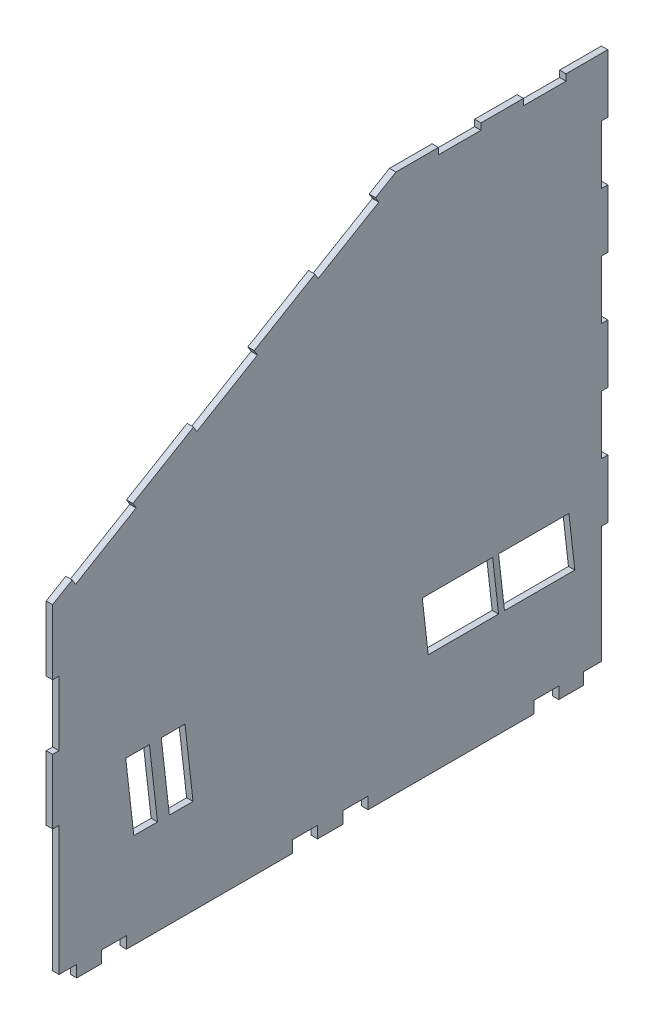
from build123d import *

# Parameters (mm, degrees)
BOSS_EXTRUDE1_DEPTH = 2.7


with BuildPart() as part:
    # Sketch1 → Boss-Extrude1 (new body)
    with BuildSketch(Plane(origin=(0, 0, 0), x_dir=(0, 0, -1), z_dir=(1, 0, 0))):
        Polygon((117.19, 87.8), (117.19, 112.5), (99.566, 112.5), (99.566, 109.8), (81.612, 109.8), (81.612, 112.5), (63.658, 112.5), (63.658, 109.8), (45.704, 109.8), (45.704, 112.5), (27.75, 112.5), (19.142256818, 107.410131897), (20.516521206, 105.086041238), (-5.094381521, 89.941988479), (-6.468645909, 92.266079138), (-32.079548636, 77.122026379), (-30.705284249, 74.79793572), (-56.316186976, 59.653882961), (-57.690451364, 61.977973621), (-83.301354091, 46.833920862), (-81.927089703, 44.509830203), (-107.53799243, 29.365777444), (-108.912256818, 31.689868103), (-117.19, 26.7951332), (-117.19, -0.68), (-114.82, -0.68), (-114.49, -0.68), (-114.49, -27.96), (-114.82, -27.96), (-117.19, -27.96), (-117.19, -55.24), (-114.82, -55.24), (-114.49, -55.24), (-114.49, -109.8), (-107.013333333, -109.8), (-107.013333333, -112.5), (-107.013333333, -114.8), (-96.506666667, -114.8), (-96.506666667, -112.5), (-96.506666667, -109.8), (-86, -109.8), (-86, -112.5), (-86, -114.8), (-16, -114.8), (-16, -112.5), (-16, -109.8), (-5.333333333, -109.8), (-5.333333333, -112.5), (-5.333333333, -114.8), (5.333333333, -114.8), (5.333333333, -112.5), (5.333333333, -109.8), (16, -109.8), (16, -112.5), (16, -114.8), (86, -114.8), (86, -112.5), (86, -109.8), (96.506666667, -109.8), (96.506666667, -112.5), (96.506666667, -114.8), (107.013333333, -114.8), (107.013333333, -112.5), (107.013333333, -109.8), (114.49, -109.8), (114.49, -60.4), (114.82, -60.4), (117.19, -60.4), (117.19, -35.7), (114.82, -35.7), (114.49, -35.7), (114.49, -11), (114.82, -11), (117.19, -11), (117.19, 13.7), (114.82, 13.7), (114.49, 13.7), (114.49, 38.4), (114.82, 38.4), (117.19, 38.4), (117.19, 63.1), (114.82, 63.1), (114.49, 63.1), (114.49, 87.8), (114.82, 87.8), align=None)
        Polygon((-76.32, -44.8), (-72.910909091, -74.8), (-82.910909091, -74.8), (-86.32, -44.8), align=None, mode=Mode.SUBTRACT)
        Polygon((-62.910909091, -74.8), (-67.910909091, -74.8), (-71.32, -44.8), (-66.32, -44.8), (-61.32, -44.8), (-57.910909091, -74.8), align=None, mode=Mode.SUBTRACT)
        Polygon((41.38, -48.8), (68.58, -48.8), (71.08, -70.8), (41.38, -70.8), (38.88, -48.8), align=None, mode=Mode.SUBTRACT)
        Polygon((71.08, -48.8), (100.78, -48.8), (103.28, -70.8), (100.78, -70.8), (73.58, -70.8), align=None, mode=Mode.SUBTRACT)
    extrude(amount=BOSS_EXTRUDE1_DEPTH)


solid = part.part
